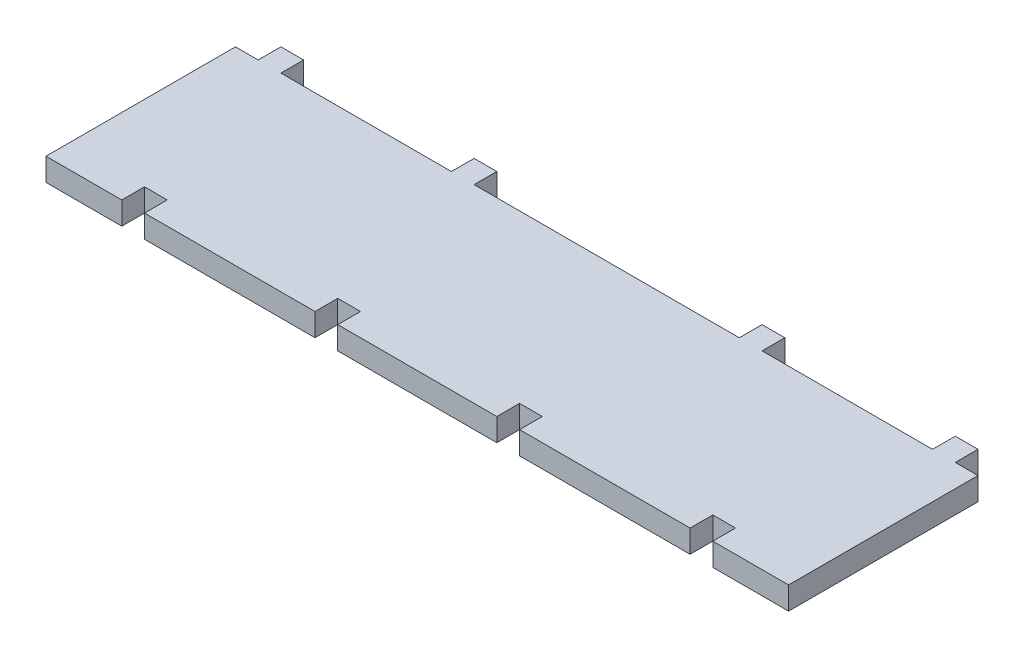
from build123d import *

# Parameters (mm, degrees)
SKETCH1_W           = 196
SKETCH1_H           = 6
BOSS_EXTRUDE1_DEPTH = 50
SKETCH2_W           = 6
SKETCH2_H           = 6
BOSS_EXTRUDE2_DEPTH = 6
SKETCH3_W           = 6
SKETCH3_H           = 6
CUT_EXTRUDE1_DEPTH  = 6


with BuildPart() as part:
    # Sketch1 → Boss-Extrude1 (new body)
    with BuildSketch(Plane.XY):
        with Locations((0, 3)):
            Rectangle(SKETCH1_W, SKETCH1_H)
    extrude(amount=BOSS_EXTRUDE1_DEPTH)

    # Sketch2 → Boss-Extrude2 (add)
    with BuildSketch(Plane(origin=(0, 0, 0), x_dir=(-1, 0, 0), z_dir=(0, 0, -1))):
        with Locations((-89, 3)):
            Rectangle(SKETCH2_W, SKETCH2_H)
        with Locations((-38, 3)):
            Rectangle(SKETCH2_W, SKETCH2_H)
        with Locations((38, 3)):
            Rectangle(SKETCH2_W, SKETCH2_H)
        with Locations((89, 3)):
            Rectangle(SKETCH2_W, SKETCH2_H)
    extrude(amount=BOSS_EXTRUDE2_DEPTH)

    # Sketch3 → Cut-Extrude1 (cut)
    with BuildSketch(Plane(origin=(0, 6, 0), x_dir=(1, 0, 0), z_dir=(0, 1, 0))):
        with Locations((75, -47)):
            Rectangle(SKETCH3_W, SKETCH3_H)
        with Locations((24, -47)):
            Rectangle(SKETCH3_W, SKETCH3_H)
        with Locations((-24, -47)):
            Rectangle(SKETCH3_W, SKETCH3_H)
        with Locations((-75, -47)):
            Rectangle(SKETCH3_W, SKETCH3_H)
    extrude(amount=-CUT_EXTRUDE1_DEPTH, mode=Mode.SUBTRACT)


solid = part.part
